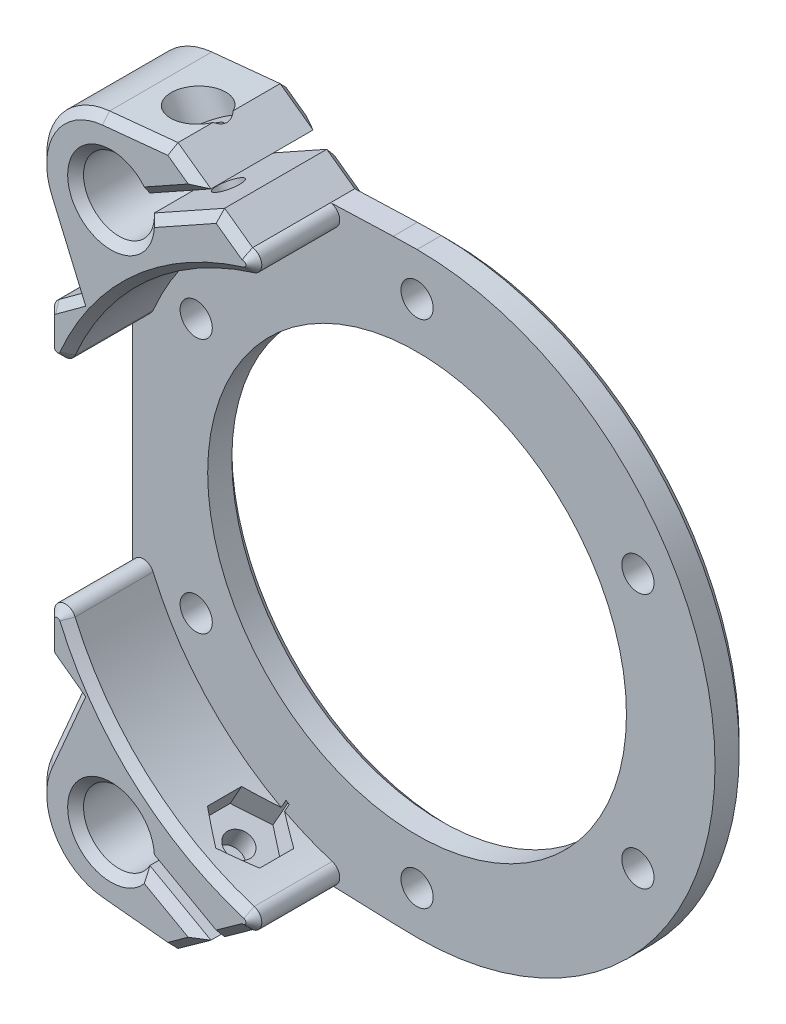
from build123d import *

# Parameters (mm, degrees)
SKETCH1_R           = 3.0000000000000004
SKETCH1_R_2         = 19.499999999999996
BOSS_EXTRUDE1_DEPTH = 3
CUT_EXTRUDE1_DEPTH  = 85.92239104029044
SKETCH3_R           = 3.2999999999999914
BOSS_EXTRUDE2_DEPTH = 3
FILLET1_R           = 6.5
SKETCH4_R           = 1.5000000000000042
SKETCH4_R_2         = 1.4999999999999973
SKETCH4_R_3         = 1.5000000000000009
CUT_EXTRUDE2_DEPTH  = 86.57976596763909
SKETCH5_W           = 197.96063853035466
SKETCH5_H           = 105.83016834927265
CUT_EXTRUDE3_DEPTH  = 86.57976596763909
SKETCH6_R           = 3.2999999999999914
BOSS_EXTRUDE3_DEPTH = 8
FILLET2_R           = 1
CUT_EXTRUDE4_DEPTH  = 85.50789219401865
CUT_EXTRUDE5_START  = 10
SKETCH8_R           = 1.2000000000000004
CUT_EXTRUDE5_DEPTH  = 18.00000000000001
CUT_EXTRUDE6_START  = 10
SKETCH9_R           = 2.3249999999999984
CUT_EXTRUDE6_DEPTH  = 6.000000000000009
CUT_EXTRUDE7_START  = -5
CUT_EXTRUDE7_DEPTH  = 3.000000000000009
CHAMFER1_SIZE       = 0.75
CHAMFER2_SIZE       = 0.74


with BuildPart() as part:
    # Sketch1 → Boss-Extrude1 (new body)
    with BuildSketch(Plane.XY):
        Polygon((0, 36.75), (-10.000000000000002, 33.333681382493936), (-15.000000000000002, 29.000000000000007), (-58.050000000000004, 27.499999999999993), (-76.5, 14), (-76.5, -14), (-58.050000000000004, -27.500000000000007), (-14.999999999999998, -28.999999999999993), (-9.99999999999998, -33.333681382493936), (0, -36.75), (9.999999999999998, -33.333681382493936), (15.000000000000002, -28.999999999999996), (58.050000000000004, -27.500000000000007), (76.5, -14), (76.5, 14), (58.050000000000004, 27.499999999999993), (14.999999999999998, 29.000000000000007), (9.999999999999998, 33.333681382493936), align=None)
        with Locations((0, 30)):
            Circle(SKETCH1_R, mode=Mode.SUBTRACT)
        with Locations((-49.99999999999999, 0)):
            Circle(SKETCH1_R_2, mode=Mode.SUBTRACT)
        with Locations(Location((50.00000000000001, 1.225e-14, 0), (0, 0, 180))):
            Circle(SKETCH1_R_2, mode=Mode.SUBTRACT)
        with Locations(Location((0, -30, 0), (0, 0, 180))):
            Circle(SKETCH1_R, mode=Mode.SUBTRACT)
    extrude(amount=BOSS_EXTRUDE1_DEPTH)

    # Sketch2 → Cut-Extrude1 (cut, through all)
    with BuildSketch(Plane.XY.offset(3)):
        with BuildLine():
            Line((8.5, 20.000000000000007), (-8.5, 20))
            ThreePointArc((-8.5, 20), (-11.32842712474619, 18.82842712474619), (-12.5, 16))
            Line((-12.5, 16), (-12.499999999999996, -16))
            ThreePointArc((-12.499999999999996, -16), (-11.328427124746181, -18.828427124746188), (-8.499999999999993, -19.999999999999996))
            Line((-8.499999999999993, -19.999999999999996), (8.500000000000007, -19.999999999999996))
            ThreePointArc((8.500000000000007, -19.999999999999996), (11.328427124746195, -18.828427124746185), (12.500000000000004, -15.999999999999996))
            Line((12.500000000000004, -15.999999999999996), (12.5, 16.000000000000004))
            ThreePointArc((12.5, 16.000000000000004), (11.328427124746193, 18.828427124746195), (8.5, 20.000000000000007))
        make_face()
    extrude(amount=-CUT_EXTRUDE1_DEPTH, mode=Mode.SUBTRACT)

    # Sketch3 → Boss-Extrude2 (add)
    # profile 1 of 4: a face of its own
    with BuildSketch(Plane.XY.offset(3)):
        Polygon((-58.049999999999955, 27.50000000000001), (-65, 32.5), (-80.20458006493874, 31), (-73.76666666666668, 16), align=None)
        with Locations((-70.5, 25.5)):
            Circle(SKETCH3_R, mode=Mode.SUBTRACT)
    # profile 2 of 4: a face of its own
    with BuildSketch(Plane.XY.offset(3)):
        Polygon((73.76666666666668, 16), (58.049999999999955, 27.50000000000001), (65, 32.5), (80.20458006493874, 31), align=None)
        with Locations(Location((70.5, 25.5, 0), (0, 0, 180))):
            Circle(SKETCH3_R, mode=Mode.SUBTRACT)
    # profile 3 of 4: a face of its own
    with BuildSketch(Plane.XY.offset(3)):
        Polygon((58.04999999999996, -27.499999999999996), (65, -32.5), (80.20458006493874, -31), (73.76666666666668, -16), align=None)
        with Locations((70.5, -25.5)):
            Circle(SKETCH3_R, mode=Mode.SUBTRACT)
    # profile 4 of 4: a face of its own
    with BuildSketch(Plane.XY.offset(3)):
        Polygon((-73.76666666666668, -16), (-58.04999999999996, -27.499999999999996), (-65, -32.5), (-80.20458006493874, -31), align=None)
        with Locations(Location((-70.5, -25.5, 0), (0, 0, 180))):
            Circle(SKETCH3_R, mode=Mode.SUBTRACT)
    extrude(amount=-BOSS_EXTRUDE2_DEPTH)

    # Fillet1
    fillet1_edges = [part.edges().sort_by_distance(p)[0] for p in [
        (-80.20458006493874, 31, 1.5),
        (80.20458006493874, 31, 1.5),
        (80.20458006493874, -31, 1.5),
        (-80.20458006493874, -31, 1.5),
    ]]
    fillet(fillet1_edges, radius=FILLET1_R)

    # Sketch4 → Cut-Extrude2 (cut, through all)
    with BuildSketch(Plane.XY.offset(3)):
        with Locations((-49.99999999999999, 23.750000000000004)):
            Circle(SKETCH4_R)
        with Locations((-70.56810333987994, 11.87499999999908)):
            Circle(SKETCH4_R_2)
        with Locations((-70.56810333987887, -11.875000000000975)):
            Circle(SKETCH4_R_2)
        with Locations((-49.99999999999782, -23.750000000000007)):
            Circle(SKETCH4_R)
        with Locations((-29.43189666011796, -11.874999999998934)):
            Circle(SKETCH4_R_3)
        with Locations((-29.431896660119207, 11.875000000001107)):
            Circle(SKETCH4_R_3)
        with Locations(Location((29.431896660119207, 11.875000000001135, 0), (0, 0, 180))):
            Circle(SKETCH4_R_3)
        with Locations(Location((29.43189666011796, -11.874999999998908, 0), (0, 0, 180))):
            Circle(SKETCH4_R_3)
        with Locations(Location((49.99999999999782, -23.74999999999995, 0), (0, 0, 180))):
            Circle(SKETCH4_R)
        with Locations(Location((70.56810333987887, -11.875000000000947, 0), (0, 0, 180))):
            Circle(SKETCH4_R_2)
        with Locations(Location((70.56810333987994, 11.874999999999108, 0), (0, 0, 180))):
            Circle(SKETCH4_R_2)
        with Locations(Location((49.99999999999999, 23.750000000000018, 0), (0, 0, 180))):
            Circle(SKETCH4_R)
    extrude(amount=-CUT_EXTRUDE2_DEPTH, mode=Mode.SUBTRACT)

    # Sketch5 → Cut-Extrude3 (cut, through all)
    with BuildSketch(Plane.XY.offset(3)):
        with Locations((0.3552116574092139, 3.981612293671432)):
            Rectangle(SKETCH5_W, SKETCH5_H)
        with BuildLine():
            Line((-57.9916003006876, 27.58117558204423), (-49.99999999999999, 27.75))
            ThreePointArc((-49.99999999999999, 27.75), (-22.249999999999993, 0), (-49.99999999999999, -27.75))
            Line((-49.99999999999999, -27.75), (-57.9916003006876, -27.58117558204423))
            Line((-57.9916003006876, -27.58117558204423), (-64.97224681389281, -32.60322343327101))
            Line((-64.97224681389281, -32.60322343327101), (-71.37707367587572, -31.971358544405817))
            ThreePointArc((-71.37707367587572, -31.971358544405817), (-76.41184285047038, -28.75979430133998), (-76.79408844603512, -22.800185771120987))
            Line((-76.79408844603512, -22.800185771120987), (-73.88995261365207, -16.033701851433918))
            Line((-73.88995261365207, -16.033701851433918), (-76.55905099943843, -14.080703032565845))
            Line((-76.55905099943843, -14.080703032565845), (-76.5, 0))
            Line((-76.5, 0), (-76.55905099943843, 14.080703032565845))
            Line((-76.55905099943843, 14.080703032565845), (-73.88995261365207, 16.033701851433918))
            Line((-73.88995261365207, 16.033701851433918), (-76.79408844603512, 22.800185771120987))
            ThreePointArc((-76.79408844603512, 22.800185771120987), (-76.41184285047038, 28.75979430133998), (-71.37707367587572, 31.971358544405817))
            Line((-71.37707367587572, 31.971358544405817), (-64.97224681389281, 32.60322343327101))
            Line((-64.97224681389281, 32.60322343327101), (-57.9916003006876, 27.58117558204423))
        make_face(mode=Mode.SUBTRACT)
    extrude(amount=-CUT_EXTRUDE3_DEPTH, mode=Mode.SUBTRACT)

    # Sketch6 → Boss-Extrude3 (add)
    # profile 1 of 2: a face of its own
    with BuildSketch(Plane.XY.offset(3)):
        with BuildLine():
            Line((-76.70219467741117, 22.839626046070443), (-73.76666666666668, 16))
            Line((-73.76666666666668, 16), (-76.5, 14))
            Line((-76.5, 14), (-76.5, 3.648629879831583))
            ThreePointArc((-76.5, 3.648629879831583), (-67.5778504191284, 20.163870527325532), (-49.99999999999999, 26.75))
            Line((-49.99999999999999, 26.75), (-58.050000000000004, 27.499999999999993))
            Line((-58.050000000000004, 27.499999999999993), (-65, 32.5))
            Line((-65, 32.5), (-71.36725588861782, 31.87184165612369))
            ThreePointArc((-71.36725588861782, 31.87184165612369), (-76.32574068177924, 28.708937477346726), (-76.70219467741117, 22.839626046070443))
        make_face()
        with Locations((-70.5, 25.5)):
            Circle(SKETCH6_R, mode=Mode.SUBTRACT)
    # profile 2 of 2: a face of its own
    with BuildSketch(Plane.XY.offset(3)):
        with BuildLine():
            Line((-76.5, -14), (-76.5, -3.6486298798315886))
            ThreePointArc((-76.5, -3.6486298798315886), (-67.5778504191284, -20.163870527325543), (-49.999999999999986, -26.75))
            Line((-49.999999999999986, -26.75), (-58.050000000000004, -27.499999999999993))
            Line((-58.050000000000004, -27.499999999999993), (-64.99999999999999, -32.5))
            Line((-64.99999999999999, -32.5), (-71.3672558886178, -31.87184165612369))
            ThreePointArc((-71.3672558886178, -31.87184165612369), (-76.32574068177924, -28.708937477346737), (-76.70219467741117, -22.839626046070446))
            Line((-76.70219467741117, -22.839626046070446), (-73.76666666666668, -16.000000000000007))
            Line((-73.76666666666668, -16.000000000000007), (-76.5, -14))
        make_face()
        with Locations(Location((-70.5, -25.500000000000004, 0), (0, 0, 180))):
            Circle(SKETCH6_R, mode=Mode.SUBTRACT)
    extrude(amount=BOSS_EXTRUDE3_DEPTH)

    # Fillet2
    # the kernel refuses this fillet: 1 mm, written as the material it takes off along each edge
    with BuildSketch(Plane(origin=(-49.999999999999986, -26.750000000000004, 3), x_dir=(-0.9887761583970414, 0.14940451327047904, 0), z_dir=(0, 0, 1))) as fillet2_piece_1:
        with BuildLine():
            CenterArc((8.142545973241123, 0.9887761583970428), FILLET2_R, 107.15461611691443, 154.252965064784)
            Line((7.847594690143343, 1.9442884506251294), (0, 0))
            ThreePointArc((0, 0), (3.9965707299853213, 0.30023776287914367), (7.9931414599706425, 1e-17))
        make_face()
    extrude(amount=28.212155995835815, mode=Mode.SUBTRACT)
    with BuildSketch(Plane(origin=(-76.5, -3.6486298798315886, 3), x_dir=(0.2678344389516736, -0.9634649517815592, 0), z_dir=(0, 0, 1))) as fillet2_piece_2:
        with BuildLine():
            CenterArc((7.2984884614331, -0.9909925218324608), FILLET2_R, 97.69601260763352, 156.7685434949926)
            Line((7.030654022481427, -1.9544574736140201), (0, 0))
            ThreePointArc((0, 0), (3.582285620978633, -0.24095004098166345), (7.1645712419572645, 1.9e-16))
        make_face()
    extrude(amount=26.24314939915802, mode=Mode.SUBTRACT)
    with BuildSketch(Plane(origin=(-49.999999999999986, 26.75, 3), x_dir=(-0.9956879416597751, 0.09276595729749348, 0), z_dir=(0, 0, 1))) as fillet2_piece_3:
        with BuildLine():
            CenterArc((8.141371289440952, 0.9984020959642962), FILLET2_R, 112.50758834437129, 154.2529650647851)
            ThreePointArc((7.758565500354502, 1.9222309371691508), (3.951485440346435, 0.6696888298038981), (0, 0))
            Line((0, 0), (8.084862398334327, -6e-17))
        make_face()
    extrude(amount=28.212155995835815, mode=Mode.SUBTRACT)
    with BuildSketch(Plane(origin=(-76.5, 3.6486298798315833, 3), x_dir=(0.2678344389516734, 0.9634649517815593, 0), z_dir=(0, 0, 1))) as fillet2_piece_4:
        with BuildLine():
            CenterArc((7.298488461433108, 0.9909925218324613), FILLET2_R, 105.53544389737382, 156.76854349499257)
            Line((7.030654022481436, 1.9544574736140212), (0, 0))
            ThreePointArc((0, 0), (3.5822856209786367, 0.2409500409816637), (7.164571241957271, -1.3e-16))
        make_face()
    extrude(amount=26.243149399158046, mode=Mode.SUBTRACT)
    with BuildSketch(Plane(origin=(-76.5, -14, -1.268508730702571), x_dir=(0.8070303256584309, -0.5905099943842163, 0), z_dir=(0, 0, 1))) as fillet2_piece_5:
        with BuildLine():
            CenterArc((FILLET2_R * 0.507403492281, FILLET2_R), FILLET2_R, 216.19320730556473, 53.80679269443499)
            Line((-FILLET2_R * 0.299626833377, FILLET2_R * 0.409490005616), (0, 0))
            Line((0, 0), (FILLET2_R * 0.507403492281, 3e-17))
        make_face()
    extrude(amount=13.537017461405142, mode=Mode.SUBTRACT)
    with BuildSketch(Plane(origin=(-76.5, 13.999999999999996, -1.268508730702571), x_dir=(0, -1, 0), z_dir=(0, 0, 1))) as fillet2_piece_6:
        with BuildLine():
            CenterArc((FILLET2_R * 0.507403492281, FILLET2_R), FILLET2_R, 216.19320730556493, 53.8067926944351)
            Line((-FILLET2_R * 0.299626833377, FILLET2_R * 0.409490005616), (0, 0))
            Line((0, 0), (FILLET2_R * 0.507403492281, 0))
        make_face()
    extrude(amount=13.537017461405142, mode=Mode.SUBTRACT)

    # Sketch7 → Cut-Extrude4 (cut, through all)
    with BuildSketch(Plane.XY.offset(11)):
        Polygon((-68.72990303754605, 26.501333699254644), (-57.451877020110466, 32.796780579868035), (-56.75711876399617, 31.55215063748628), (-67.98850095769365, 25.282740557479496), align=None)
        Polygon((-67.98850095769365, -25.282740557479496), (-68.72990303754605, -26.501333699254644), (-57.451877020110466, -32.796780579868035), (-56.75711876399617, -31.55215063748628), align=None)
    extrude(amount=-CUT_EXTRUDE4_DEPTH, mode=Mode.SUBTRACT)

    # Sketch8 → Cut-Extrude5 (cut)
    with BuildSketch(Plane(origin=(-26.912054995734103, 48.21180484569099, 0), x_dir=(0.8731734941880153, 0.48740952908975016, 0), z_dir=(-0.48740952908975016, 0.8731734941880153, 0)).offset(CUT_EXTRUDE5_START)):
        with Locations(Location((-43.04149818074502, -6.072501206093498, 0), (0, 0, 180))):
            Circle(SKETCH8_R)
    cut_extrude5 = extrude(amount=-CUT_EXTRUDE5_DEPTH, mode=Mode.SUBTRACT)

    # Sketch9 → Cut-Extrude6 (cut)
    with BuildSketch(Plane(origin=(-26.912054995734103, 48.21180484569099, 0), x_dir=(0.8731734941880153, 0.48740952908975016, 0), z_dir=(-0.48740952908975016, 0.8731734941880153, 0)).offset(CUT_EXTRUDE6_START)):
        with Locations(Location((-43.04149818074503, -6.072501206093498, 0), (0, 0, 180))):
            Circle(SKETCH9_R)
    cut_extrude6 = extrude(amount=-CUT_EXTRUDE6_DEPTH, mode=Mode.SUBTRACT)

    # Sketch10 → Cut-Extrude7 (cut)
    with BuildSketch(Plane(origin=(-26.912054995734103, 48.21180484569099, 0), x_dir=(0.8731734941880153, 0.48740952908975016, 0), z_dir=(-0.48740952908975016, 0.8731734941880153, 0)).offset(CUT_EXTRUDE7_START)):
        Polygon((-43.04149818074503, -2.897074725550556), (-45.79149818074503, -4.484787965822029), (-45.79149818074503, -7.6602144463649715), (-43.04149818074504, -9.247927686636439), (-40.29149818074502, -7.6602144463649635), (-40.29149818074502, -4.484787965822027), align=None)
    cut_extrude7 = extrude(amount=CUT_EXTRUDE7_DEPTH, mode=Mode.SUBTRACT)

    # Mirror1: Cut-Extrude5, Cut-Extrude6, Cut-Extrude7 across plane
    add(cut_extrude5.mirror(Plane.ZX), mode=Mode.SUBTRACT)
    add(cut_extrude6.mirror(Plane.ZX), mode=Mode.SUBTRACT)
    add(cut_extrude7.mirror(Plane.ZX), mode=Mode.SUBTRACT)

    # Chamfer1
    chamfer1_edges = [part.edges().sort_by_distance(p)[0] for p in [
        (-59.35337442360563, 28.437679441442935, 0),
        (-75.23443067203893, -19.419813023035218, 0),
        (-63.467232446629296, -31.39728952994914, 0),
        (-68.18362794430891, -32.185920828061846, 0),
        (-75.23443067203893, 19.419813023035218, 0),
        (-76.32574068177924, 28.70893747734672, 0),
        (-76.32574068177924, -28.708937477346726, 0),
        (-30.931896660119207, 11.875000000001107, 0),
        (-30.93189666011796, -11.874999999998934, 0),
        (-51.499999999997826, -23.750000000000007, 0),
        (-55.136235810883896, -27.6015248846382, 0),
        (-72.06810333987887, -11.875000000000975, 0),
        (-72.06810333987994, 11.87499999999908, 0),
        (-51.5, 23.750000000000004, 0),
        (-55.136235810883576, 27.601524884638195, 0),
        (-51.11123581088389, -27.726524884638195, 0),
        (-22.249999999999993, -5.1e-15, 0),
        (-51.111235810883564, 27.726524884638206, 0),
        (-74.92858833052546, -15.14981341668869, 0),
        (-76.5, 1.78e-15, 0),
        (-76.39177070886642, 13.945084079711744, 0),
        (-76.39177070886643, -13.945084079711714, 0),
        (-69.49999999999999, 2.39e-15, 0),
        (-73.66268115589936, -24.557955464896178, 0),
        (-59.353374423605636, -28.437679441442924, 0),
        (-73.66268115589936, 24.557955464896178, 0),
        (-63.467232446629296, 31.39728952994914, 0),
        (-64.77932615180292, 28.70656419735117, -8.9e-16),
        (-63.932006221037156, 27.54709489543086, 0),
        (-63.93200622103716, -27.54709489543086, 0),
        (-64.77932615180292, -28.706564197351167, -8.9e-16),
        (-74.92858833052546, 15.149813416688687, 0),
        (-68.18362794430892, 32.18592082806184, 0),
    ]]
    chamfer(chamfer1_edges, length=CHAMFER1_SIZE)

    # Chamfer2
    chamfer2_edges = [part.edges().sort_by_distance(p)[0] for p in [
        (-76.32574068177924, 28.70893747734673, 11),
        (-75.23443067203893, 19.41981302303522, 11),
        (-74.92858833052546, 15.149813416688694, 11),
        (-59.35337442360567, 28.437679441442917, 11),
        (-68.18362794430891, 32.185920828061846, 11),
        (-76.32574068177924, -28.70893747734674, 11),
        (-68.1836279443089, -32.185920828061846, 11),
        (-63.467232446629296, -31.397289529949138, 11),
        (-75.23443067203893, -19.419813023035225, 11),
        (-74.92858833052546, -15.149813416688698, 11),
        (-76.5, -12.219243073606949, 11),
        (-76.5, 12.219243073606945, 11),
        (-67.8911548871302, -19.88640432065881, 11),
        (-75.70134681656256, -9.966369624661315, 11),
        (-57.20171264747254, -26.586320916940597, 11),
        (-76.39177070886643, -13.945084079711714, 11),
        (-67.89115488713114, 19.886404320657952, 11),
        (-75.70134681656255, 9.966369624661311, 11),
        (-57.201712647472505, 26.58632091693386, 11),
        (-76.39177070886642, 13.945084079711744, 11),
        (-59.353374423605665, -28.437679441442917, 11),
        (-73.66268115589936, -24.55795546489616, 11),
        (-64.77932615180292, -28.706564197351163, 11),
        (-63.93200622103715, -27.547094895430874, 11),
        (-63.4672324466293, 31.397289529949138, 11),
        (-73.66268115589936, 24.55795546489615, 11),
        (-63.93200622103715, 27.54709489543087, 11),
        (-64.77932615180292, 28.70656419735116, 11),
    ]]
    chamfer(chamfer2_edges, length=CHAMFER2_SIZE)


solid = part.part
